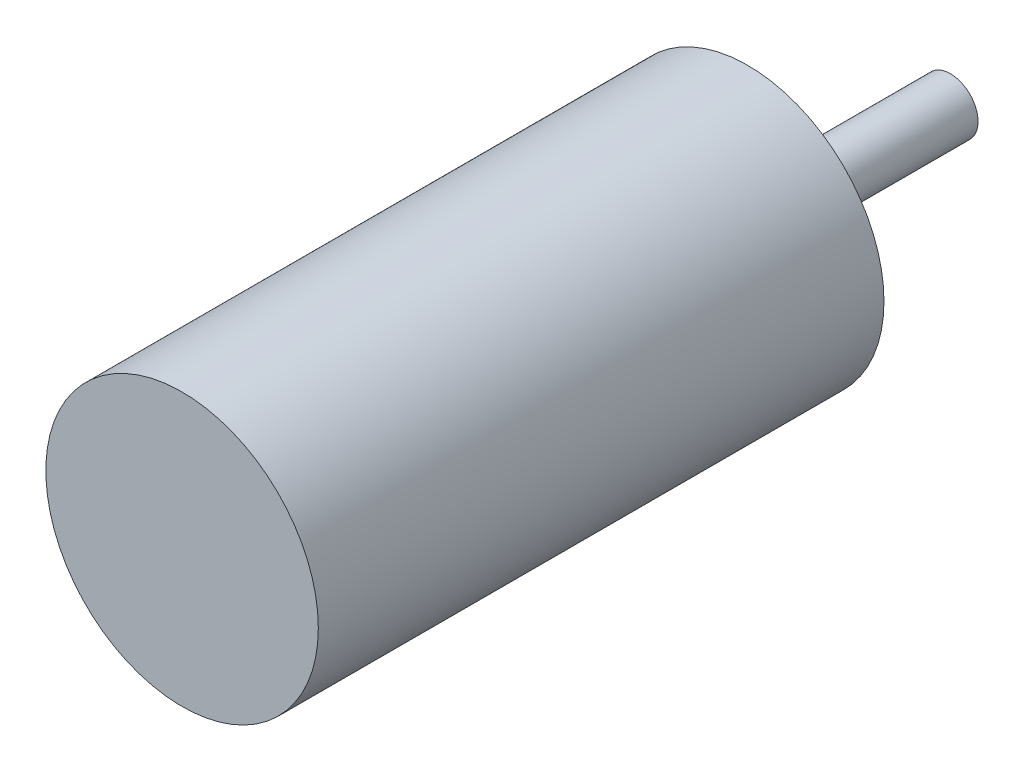
from build123d import *

# Parameters (mm, degrees)
SKETCH2_R           = 19.75
BOSS_EXTRUDE1_DEPTH = 82
SKETCH3_R           = 4
BOSS_EXTRUDE2_DEPTH = 29.3878


with BuildPart() as part:
    # Sketch2 → Boss-Extrude1 (new body)
    with BuildSketch(Plane.XY):
        Circle(SKETCH2_R)
    extrude(amount=-BOSS_EXTRUDE1_DEPTH)

    # Sketch3 → Boss-Extrude2 (add)
    with BuildSketch(Plane(origin=(0, 0, -82), x_dir=(-1, 0, 0), z_dir=(0, 0, -1))):
        Circle(SKETCH3_R)
    extrude(amount=BOSS_EXTRUDE2_DEPTH)


solid = part.part
